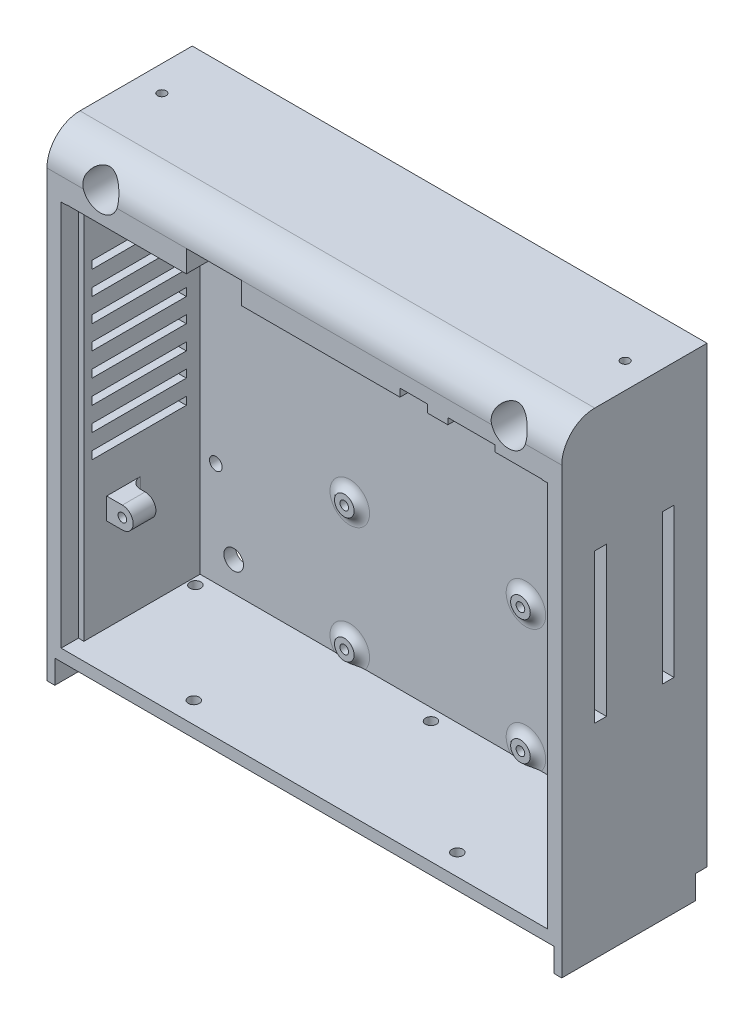
from build123d import *

# Parameters (mm, degrees)
CROQUIS1_W               = 131.1
CROQUIS1_H               = 109.5
SALIENTE_EXTRUIR2_DEPTH  = 39
CORTAR_EXTRUIR1_DEPTH    = 36
SALIENTE_EXTRUIR6_START  = 18
CROQUIS3_R               = 2.75
CROQUIS3_R_2             = 1.1
SALIENTE_EXTRUIR6_DEPTH  = 5.8
REDONDEO1_R              = 2.8
CROQUIS4_W               = 131.1
CROQUIS4_H               = 6
SALIENTE_EXTRUIR7_DEPTH  = 39
CORTAR_EXTRUIR5_START    = -10
CROQUIS7_R               = 1.6
CROQUIS7_R_2             = 1.1
CORTAR_EXTRUIR5_DEPTH    = 10
CROQUIS9_W               = 131.1
CROQUIS9_H               = 115.5
CORTAR_EXTRUIR6_DEPTH    = 2
CROQUIS10_W              = 1.4
CROQUIS10_H              = 98.387821421
CORTAR_EXTRUIR7_DEPTH    = 4.4
CORTAR_EXTRUIR9_REACH    = 180.596
CROQUIS13_R              = 2.5
CROQUIS12_R              = 4.5
CORTAR_EXTRUIR10_DEPTH   = 33
REDONDEO3_R              = 8.4
CORTAR_EXTRUIR11_REACH   = 180.596
CROQUIS15_R              = 1.1
CORTAR_EXTRUIR13_REACH   = 179.998
CROQUIS16_R              = 1.1
SALIENTE_EXTRUIR8_START  = 1.4
CROQUIS17_R              = 2.5
CROQUIS17_R_2            = 1.1
SALIENTE_EXTRUIR8_DEPTH  = 1.4
REDONDEO4_R              = 3
CORTAR_EXTRUIR14_REACH   = 180.596
CROQUIS18_W              = 4.2
CROQUIS18_H              = 16.2
CROQUIS18_H_2            = 14
CROQUIS19_W              = 2
CROQUIS19_H              = 6
SALIENTE_EXTRUIR10_DEPTH = 34
CROQUIS22_R              = 1.4
CORTAR_EXTRUIR19_DEPTH   = 3
CROQUIS5_W               = 24
CROQUIS5_H               = 2
CORTAR_EXTRUIR3_DEPTH    = 10
CROQUIS6_W               = 3
CROQUIS6_H               = 38
CORTAR_EXTRUIR4_DEPTH    = 10


with BuildPart() as part:
    # Croquis1 → Saliente-Extruir2 (new body)
    with BuildSketch(Plane.XY):
        with Locations((65.55, 54.75)):
            Rectangle(CROQUIS1_W, CROQUIS1_H)
    extrude(amount=SALIENTE_EXTRUIR2_DEPTH)

    # Croquis2 → Cortar-Extruir1 (cut)
    with BuildSketch(Plane.XY.offset(39)):
        Polygon((5, 101.5), (35.5, 101.5), (35.5, 107.1), (49.5, 107.1), (49.5, 101.5), (89.9, 101.5), (89.9, 103.5), (96.9, 103.5), (96.9, 101.5), (102.1, 101.5), (102.1, 103.1), (114.1, 103.1), (114.1, 101.5), (126.1, 101.5), (126.1, 3), (5, 3), align=None)
    extrude(amount=-CORTAR_EXTRUIR1_DEPTH, mode=Mode.SUBTRACT)

    # Croquis3 → Saliente-Extruir6 (add)
    # profile 1 of 8: a face of its own
    with BuildSketch(Plane.XY.offset(3).offset(SALIENTE_EXTRUIR6_START)):
        with Locations((9, 97.5)):
            Circle(CROQUIS3_R)
        with Locations((9, 97.5)):
            Circle(CROQUIS3_R_2, mode=Mode.SUBTRACT)
    # profile 2 of 8: a face of its own
    with BuildSketch(Plane.XY.offset(3).offset(SALIENTE_EXTRUIR6_START)):
        with BuildLine():
            ThreePointArc((9, 94.75), (6.25, 97.5), (9, 100.25))
            Line((9, 100.25), (5, 100.25))
            Line((5, 100.25), (5, 94.75))
            Line((5, 94.75), (9, 94.75))
        make_face()
    # profile 3 of 8: a face of its own
    with BuildSketch(Plane.XY.offset(3).offset(SALIENTE_EXTRUIR6_START)):
        with Locations((122.1, 97.5)):
            Circle(CROQUIS3_R)
        with Locations((122.1, 97.5)):
            Circle(CROQUIS3_R_2, mode=Mode.SUBTRACT)
    # profile 4 of 8: a face of its own
    with BuildSketch(Plane.XY.offset(3).offset(SALIENTE_EXTRUIR6_START)):
        with BuildLine():
            Line((122.1, 94.75), (126.1, 94.75))
            Line((126.1, 94.75), (126.1, 100.25))
            Line((126.1, 100.25), (122.1, 100.25))
            ThreePointArc((122.1, 100.25), (124.044543648, 99.444543648), (124.85, 97.5))
            ThreePointArc((124.85, 97.5), (124.044543648, 95.555456352), (122.1, 94.75))
        make_face()
    # profile 5 of 8: a face of its own
    with BuildSketch(Plane.XY.offset(3).offset(SALIENTE_EXTRUIR6_START)):
        with Locations((122.1, 29.4)):
            Circle(CROQUIS3_R)
        with Locations((122.1, 29.4)):
            Circle(CROQUIS3_R_2, mode=Mode.SUBTRACT)
    # profile 6 of 8: a face of its own
    with BuildSketch(Plane.XY.offset(3).offset(SALIENTE_EXTRUIR6_START)):
        with BuildLine():
            ThreePointArc((124.85, 29.4), (124.044543648, 27.455456352), (122.1, 26.65))
            Line((122.1, 26.65), (126.1, 26.65))
            Line((126.1, 26.65), (126.1, 32.15))
            Line((126.1, 32.15), (122.1, 32.15))
            ThreePointArc((122.1, 32.15), (124.044543648, 31.344543648), (124.85, 29.4))
        make_face()
    # profile 7 of 8: a face of its own
    with BuildSketch(Plane.XY.offset(3).offset(SALIENTE_EXTRUIR6_START)):
        with Locations((9, 29.4)):
            Circle(CROQUIS3_R)
        with Locations((9, 29.4)):
            Circle(CROQUIS3_R_2, mode=Mode.SUBTRACT)
    # profile 8 of 8: a face of its own
    with BuildSketch(Plane.XY.offset(3).offset(SALIENTE_EXTRUIR6_START)):
        with BuildLine():
            Line((9, 32.15), (5, 32.15))
            Line((5, 32.15), (5, 26.65))
            Line((5, 26.65), (9, 26.65))
            ThreePointArc((9, 26.65), (6.25, 29.4), (9, 32.15))
        make_face()
    extrude(amount=SALIENTE_EXTRUIR6_DEPTH)

    # Redondeo1
    redondeo1_edges = [part.edges().sort_by_distance(p)[0] for p in [
        (5, 97.5, 21),
        (126.1, 97.5, 21),
        (126.1, 29.4, 21),
        (5, 29.4, 21),
    ]]
    fillet(redondeo1_edges, radius=REDONDEO1_R)

    # Croquis4 → Saliente-Extruir7 (add)
    with BuildSketch(Plane.XY.offset(39)):
        with Locations((65.55, 112.5)):
            Rectangle(CROQUIS4_W, CROQUIS4_H)
    extrude(amount=-SALIENTE_EXTRUIR7_DEPTH)

    # Croquis7 → Cortar-Extruir5 (cut)
    # profile 1 of 8: a face of its own
    with BuildSketch(Plane.XY.offset(3).offset(CORTAR_EXTRUIR5_START)):
        with Locations((9, 97.5)):
            Circle(CROQUIS7_R)
        with Locations((9, 97.5)):
            Circle(CROQUIS7_R_2, mode=Mode.SUBTRACT)
    # profile 2 of 8: a face of its own
    with BuildSketch(Plane.XY.offset(3).offset(CORTAR_EXTRUIR5_START)):
        with Locations((9, 97.5)):
            Circle(CROQUIS7_R_2)
    # profile 3 of 8: a face of its own
    with BuildSketch(Plane.XY.offset(3).offset(CORTAR_EXTRUIR5_START)):
        with Locations((122.1, 97.5)):
            Circle(CROQUIS7_R)
        with Locations((122.1, 97.5)):
            Circle(CROQUIS7_R_2, mode=Mode.SUBTRACT)
    # profile 4 of 8: a face of its own
    with BuildSketch(Plane.XY.offset(3).offset(CORTAR_EXTRUIR5_START)):
        with Locations((122.1, 97.5)):
            Circle(CROQUIS7_R_2)
    # profile 5 of 8: a face of its own
    with BuildSketch(Plane.XY.offset(3).offset(CORTAR_EXTRUIR5_START)):
        with Locations((122.1, 29.4)):
            Circle(CROQUIS7_R)
        with Locations((122.1, 29.4)):
            Circle(CROQUIS7_R_2, mode=Mode.SUBTRACT)
    # profile 6 of 8: a face of its own
    with BuildSketch(Plane.XY.offset(3).offset(CORTAR_EXTRUIR5_START)):
        with Locations((122.1, 29.4)):
            Circle(CROQUIS7_R_2)
    # profile 7 of 8: a face of its own
    with BuildSketch(Plane.XY.offset(3).offset(CORTAR_EXTRUIR5_START)):
        with Locations((9, 29.4)):
            Circle(CROQUIS7_R)
        with Locations((9, 29.4)):
            Circle(CROQUIS7_R_2, mode=Mode.SUBTRACT)
    # profile 8 of 8: a face of its own
    with BuildSketch(Plane.XY.offset(3).offset(CORTAR_EXTRUIR5_START)):
        with Locations((9, 29.4)):
            Circle(CROQUIS7_R_2)
    extrude(amount=CORTAR_EXTRUIR5_DEPTH, mode=Mode.SUBTRACT)

    # Croquis9 → Cortar-Extruir6 (cut)
    with BuildSketch(Plane.XY.offset(39)):
        with Locations((65.55, 57.75)):
            Rectangle(CROQUIS9_W, CROQUIS9_H)
    extrude(amount=-CORTAR_EXTRUIR6_DEPTH, mode=Mode.SUBTRACT)

    # Croquis10 → Cortar-Extruir7 (cut)
    with BuildSketch(Plane.XY.offset(37)):
        with Locations((4.3, 52.193910711)):
            Rectangle(CROQUIS10_W, CROQUIS10_H)
        with Locations((126.8, 52.193910711)):
            Rectangle(CROQUIS10_W, CROQUIS10_H)
    extrude(amount=-CORTAR_EXTRUIR7_DEPTH, mode=Mode.SUBTRACT)

    # Croquis13 → Cortar-Extruir9 (cut, up to next)
    with BuildSketch(Plane.XY.offset(37), mode=Mode.PRIVATE) as cortar_extruir9_sk1:
        with Locations((13.55, 108.5)):
            Circle(CROQUIS13_R)
    cortar_extruir9_tool1 = extrude(cortar_extruir9_sk1.sketch, amount=-CORTAR_EXTRUIR9_REACH, mode=Mode.PRIVATE) & part.part
    # Croquis13 → Cortar-Extruir9 (cut, up to next)
    with BuildSketch(Plane.XY.offset(37), mode=Mode.PRIVATE) as cortar_extruir9_sk2:
        with Locations((117.55, 108.5)):
            Circle(CROQUIS13_R)
    cortar_extruir9_tool2 = extrude(cortar_extruir9_sk2.sketch, amount=-CORTAR_EXTRUIR9_REACH, mode=Mode.PRIVATE) & part.part
    # Croquis13 → Cortar-Extruir9 (cut, up to next)
    with BuildSketch(Plane.XY.offset(37), mode=Mode.PRIVATE) as cortar_extruir9_sk3:
        with Locations(Location((13.55, 10.5, 0), (0, 0, 180))):
            Circle(CROQUIS13_R)
    cortar_extruir9_tool3 = extrude(cortar_extruir9_sk3.sketch, amount=-CORTAR_EXTRUIR9_REACH, mode=Mode.PRIVATE) & part.part
    # Croquis13 → Cortar-Extruir9 (cut, up to next)
    with BuildSketch(Plane.XY.offset(37), mode=Mode.PRIVATE) as cortar_extruir9_sk4:
        with Locations(Location((117.55, 10.5, 0), (0, 0, 180))):
            Circle(CROQUIS13_R)
    cortar_extruir9_tool4 = extrude(cortar_extruir9_sk4.sketch, amount=-CORTAR_EXTRUIR9_REACH, mode=Mode.PRIVATE) & part.part
    add(cortar_extruir9_tool1.solids().sort_by_distance((13.55, 108.5, 37))[0], mode=Mode.SUBTRACT)
    add(cortar_extruir9_tool2.solids().sort_by_distance((117.55, 108.5, 37))[0], mode=Mode.SUBTRACT)
    add(cortar_extruir9_tool3.solids().sort_by_distance((13.55, 10.5, 37))[0], mode=Mode.SUBTRACT)
    add(cortar_extruir9_tool4.solids().sort_by_distance((117.55, 10.5, 37))[0], mode=Mode.SUBTRACT)

    # Croquis12 → Cortar-Extruir10 (cut)
    with BuildSketch(Plane.XY.offset(37)):
        with Locations((13.55, 108.5)):
            Circle(CROQUIS12_R)
        with Locations(Location((117.55, 108.5, 0), (0, 0, 180))):
            Circle(CROQUIS12_R)
        with Locations((13.55, 10.5)):
            Circle(CROQUIS12_R)
        with Locations((117.55, 10.5)):
            Circle(CROQUIS12_R)
    extrude(amount=-CORTAR_EXTRUIR10_DEPTH, mode=Mode.SUBTRACT)

    # Redondeo3
    # the kernel refuses this fillet: 8.4 mm, written as the material it takes off along each edge
    with BuildSketch(Plane(origin=(152.1, 115.5, 37), x_dir=(0, -1, 0), z_dir=(-1, 0, 0))) as redondeo3_piece_1:
        with BuildLine():
            CenterArc((REDONDEO3_R, -REDONDEO3_R), REDONDEO3_R, 90, 90)
            Line((0, -REDONDEO3_R), (0, 0))
            Line((0, 0), (REDONDEO3_R, 0))
        make_face()
    extrude(amount=173.1, mode=Mode.SUBTRACT)

    # Croquis15 → Cortar-Extruir11 (cut, up to next)
    with BuildSketch(Plane(origin=(0, 115.5, 0), x_dir=(1, 0, 0), z_dir=(0, 1, 0)), mode=Mode.PRIVATE) as cortar_extruir11_sk1:
        with Locations(Location((6.55, -14.3, 0), (0, 0, 180))):
            Circle(CROQUIS15_R)
    cortar_extruir11_tool1 = extrude(cortar_extruir11_sk1.sketch, amount=-CORTAR_EXTRUIR11_REACH, mode=Mode.PRIVATE) & part.part
    # Croquis15 → Cortar-Extruir11 (cut, up to next)
    with BuildSketch(Plane(origin=(0, 115.5, 0), x_dir=(1, 0, 0), z_dir=(0, 1, 0)), mode=Mode.PRIVATE) as cortar_extruir11_sk2:
        with Locations(Location((124.55, -14.3, 0), (0, 0, 90))):
            Circle(CROQUIS15_R)
    cortar_extruir11_tool2 = extrude(cortar_extruir11_sk2.sketch, amount=-CORTAR_EXTRUIR11_REACH, mode=Mode.PRIVATE) & part.part
    add(cortar_extruir11_tool1.solids().sort_by_distance((6.55, 115.5, 14.3))[0], mode=Mode.SUBTRACT)
    add(cortar_extruir11_tool2.solids().sort_by_distance((124.55, 115.5, 14.3))[0], mode=Mode.SUBTRACT)

    # Croquis16 → Cortar-Extruir13 (cut, up to next)
    with BuildSketch(Plane.XY.offset(3), mode=Mode.PRIVATE) as cortar_extruir13_sk1:
        with Locations((43.12, 37.93)):
            Circle(CROQUIS16_R)
    cortar_extruir13_tool1 = extrude(cortar_extruir13_sk1.sketch, amount=-CORTAR_EXTRUIR13_REACH, mode=Mode.PRIVATE) & part.part
    # Croquis16 → Cortar-Extruir13 (cut, up to next)
    with BuildSketch(Plane.XY.offset(3), mode=Mode.PRIVATE) as cortar_extruir13_sk2:
        with Locations((87.98, 37.93)):
            Circle(CROQUIS16_R)
    cortar_extruir13_tool2 = extrude(cortar_extruir13_sk2.sketch, amount=-CORTAR_EXTRUIR13_REACH, mode=Mode.PRIVATE) & part.part
    # Croquis16 → Cortar-Extruir13 (cut, up to next)
    with BuildSketch(Plane.XY.offset(3), mode=Mode.PRIVATE) as cortar_extruir13_sk3:
        with Locations((87.98, 6.17)):
            Circle(CROQUIS16_R)
    cortar_extruir13_tool3 = extrude(cortar_extruir13_sk3.sketch, amount=-CORTAR_EXTRUIR13_REACH, mode=Mode.PRIVATE) & part.part
    # Croquis16 → Cortar-Extruir13 (cut, up to next)
    with BuildSketch(Plane.XY.offset(3), mode=Mode.PRIVATE) as cortar_extruir13_sk4:
        with Locations((43.12, 6.17)):
            Circle(CROQUIS16_R)
    cortar_extruir13_tool4 = extrude(cortar_extruir13_sk4.sketch, amount=-CORTAR_EXTRUIR13_REACH, mode=Mode.PRIVATE) & part.part
    add(cortar_extruir13_tool1.solids().sort_by_distance((43.12, 37.93, 3))[0], mode=Mode.SUBTRACT)
    add(cortar_extruir13_tool2.solids().sort_by_distance((87.98, 37.93, 3))[0], mode=Mode.SUBTRACT)
    add(cortar_extruir13_tool3.solids().sort_by_distance((87.98, 6.17, 3))[0], mode=Mode.SUBTRACT)
    add(cortar_extruir13_tool4.solids().sort_by_distance((43.12, 6.17, 3))[0], mode=Mode.SUBTRACT)

    # Croquis17 → Saliente-Extruir8 (add)
    # profile 1 of 4: a face of its own
    with BuildSketch(Plane.XY.offset(3).offset(SALIENTE_EXTRUIR8_START)):
        with Locations(Location((43.12, 37.93, 0), (0, 0, 180))):
            Circle(CROQUIS17_R)
        with Locations((43.12, 37.93)):
            Circle(CROQUIS17_R_2, mode=Mode.SUBTRACT)
    # profile 2 of 4: a face of its own
    with BuildSketch(Plane.XY.offset(3).offset(SALIENTE_EXTRUIR8_START)):
        with Locations(Location((87.98, 37.93, 0), (0, 0, 180))):
            Circle(CROQUIS17_R)
        with Locations((87.98, 37.93)):
            Circle(CROQUIS17_R_2, mode=Mode.SUBTRACT)
    # profile 3 of 4: a face of its own
    with BuildSketch(Plane.XY.offset(3).offset(SALIENTE_EXTRUIR8_START)):
        with Locations(Location((87.98, 6.17, 0), (0, 0, 180))):
            Circle(CROQUIS17_R)
        with Locations((87.98, 6.17)):
            Circle(CROQUIS17_R_2, mode=Mode.SUBTRACT)
    # profile 4 of 4: a face of its own
    with BuildSketch(Plane.XY.offset(3).offset(SALIENTE_EXTRUIR8_START)):
        with Locations(Location((43.12, 6.17, 0), (0, 0, 180))):
            Circle(CROQUIS17_R)
        with Locations((43.12, 6.17)):
            Circle(CROQUIS17_R_2, mode=Mode.SUBTRACT)
    extrude(amount=-SALIENTE_EXTRUIR8_DEPTH)

    # Redondeo4
    # the kernel refuses this fillet: 3 mm, written as the material it adds along each edge
    with BuildSketch(Plane(origin=(43.12, 37.93, 3), x_dir=(-1, 0, 0), z_dir=(0, 1, 0))) as redondeo4_piece_1:
        with BuildLine():
            CenterArc((5.037715508, 3), REDONDEO4_R, 212.230952635, 57.769047365)
            Line((5.037715508, 0), (5.037715508, -0.06))
            Line((5.037715508, -0.06), (2.5, -0.06))
            Line((2.5, -0.06), (2.44, 0))
            ThreePointArc((2.44, 0), (2.44, 0.7), (2.44924569, 1.368))
            Line((2.44924569, 1.368), (2.5, 1.4))
        make_face()
    revolve(axis=Axis((43.12, 37.93, 3), (0, 0, 1)))
    with BuildSketch(Plane(origin=(87.98, 37.93, 3), x_dir=(-1, 0, 0), z_dir=(0, 1, 0))) as redondeo4_piece_2:
        with BuildLine():
            CenterArc((5.037715508, 3), REDONDEO4_R, 212.230952635, 57.769047365)
            Line((5.037715508, 0), (5.037715508, -0.06))
            Line((5.037715508, -0.06), (2.5, -0.06))
            Line((2.5, -0.06), (2.44, 0))
            ThreePointArc((2.44, 0), (2.44, 0.7), (2.44924569, 1.368))
            Line((2.44924569, 1.368), (2.5, 1.4))
        make_face()
    revolve(axis=Axis((87.98, 37.93, 3), (0, 0, 1)))
    with BuildSketch(Plane(origin=(87.98, 6.17, 3), x_dir=(-1, 0, 0), z_dir=(0, 1, 0))) as redondeo4_piece_3:
        with BuildLine():
            CenterArc((5.037715508, 3), REDONDEO4_R, 212.230952635, 57.769047365)
            Line((5.037715508, 0), (5.037715508, -0.06))
            Line((5.037715508, -0.06), (2.5, -0.06))
            Line((2.5, -0.06), (2.44, 0))
            ThreePointArc((2.44, 0), (2.44, 0.7), (2.44924569, 1.368))
            Line((2.44924569, 1.368), (2.5, 1.4))
        make_face()
    revolve(axis=Axis((87.98, 6.17, 3), (0, 0, 1)))
    with BuildSketch(Plane(origin=(43.12, 6.17, 3), x_dir=(-1, 0, 0), z_dir=(0, 1, 0))) as redondeo4_piece_4:
        with BuildLine():
            CenterArc((5.037715508, 3), REDONDEO4_R, 212.230952635, 57.769047365)
            Line((5.037715508, 0), (5.037715508, -0.06))
            Line((5.037715508, -0.06), (2.5, -0.06))
            Line((2.5, -0.06), (2.44, 0))
            ThreePointArc((2.44, 0), (2.44, 0.7), (2.44924569, 1.368))
            Line((2.44924569, 1.368), (2.5, 1.4))
        make_face()
    revolve(axis=Axis((43.12, 6.17, 3), (0, 0, 1)))

    # Croquis18 → Cortar-Extruir14 (cut, up to next)
    with BuildSketch(Plane.XZ, mode=Mode.PRIVATE) as cortar_extruir14_sk1:
        with Locations((65.55, 18.5)):
            Rectangle(CROQUIS18_W, CROQUIS18_H)
    cortar_extruir14_tool1 = extrude(cortar_extruir14_sk1.sketch, amount=-CORTAR_EXTRUIR14_REACH, mode=Mode.PRIVATE) & part.part
    # Croquis18 → Cortar-Extruir14 (cut, up to next)
    with BuildSketch(Plane.XZ, mode=Mode.PRIVATE) as cortar_extruir14_sk2:
        with Locations((48.9, 18.5)):
            Rectangle(CROQUIS18_W, CROQUIS18_H_2)
    cortar_extruir14_tool2 = extrude(cortar_extruir14_sk2.sketch, amount=-CORTAR_EXTRUIR14_REACH, mode=Mode.PRIVATE) & part.part
    # Croquis18 → Cortar-Extruir14 (cut, up to next)
    with BuildSketch(Plane.XZ, mode=Mode.PRIVATE) as cortar_extruir14_sk3:
        with Locations((101.2, 18.5)):
            Rectangle(CROQUIS18_W, CROQUIS18_H)
    cortar_extruir14_tool3 = extrude(cortar_extruir14_sk3.sketch, amount=-CORTAR_EXTRUIR14_REACH, mode=Mode.PRIVATE) & part.part
    add(cortar_extruir14_tool1.solids().sort_by_distance((65.55, 0, 18.5))[0], mode=Mode.SUBTRACT)
    add(cortar_extruir14_tool2.solids().sort_by_distance((48.9, 0, 18.5))[0], mode=Mode.SUBTRACT)
    add(cortar_extruir14_tool3.solids().sort_by_distance((101.2, 0, 18.5))[0], mode=Mode.SUBTRACT)

    # Croquis19 → Saliente-Extruir10 (add)
    with BuildSketch(Plane.XY.offset(37)):
        with Locations((1, -3)):
            Rectangle(CROQUIS19_W, CROQUIS19_H)
        with Locations((1, -3)):
            Rectangle(CROQUIS19_W, CROQUIS19_H)
        with BuildLine():
            Line((0, 107.1), (0, 0))
            Line((0, 0), (2, 0))
            Line((2, 0), (57, 0))
            Line((57, 0), (59, 0))
            Line((59, 0), (91.1, 0))
            Line((91.1, 0), (93.1, 0))
            Line((93.1, 0), (129.1, 0))
            Line((129.1, 0), (131.1, 0))
            Line((131.1, 0), (131.1, 107.1))
            Line((131.1, 107.1), (121.826680956, 107.1))
            ThreePointArc((121.826680956, 107.1), (117.55, 104), (113.273319044, 107.1))
            Line((113.273319044, 107.1), (49.5, 107.1))
            Line((49.5, 107.1), (49.5, 101.5))
            Line((49.5, 101.5), (89.9, 101.5))
            Line((89.9, 101.5), (89.9, 103.5))
            Line((89.9, 103.5), (96.9, 103.5))
            Line((96.9, 103.5), (96.9, 101.5))
            Line((96.9, 101.5), (102.1, 101.5))
            Line((102.1, 101.5), (102.1, 103.1))
            Line((102.1, 103.1), (114.1, 103.1))
            Line((114.1, 103.1), (114.1, 101.5))
            Line((114.1, 101.5), (126.1, 101.5))
            Line((126.1, 101.5), (126.1, 101.387821421))
            Line((126.1, 101.387821421), (127.5, 101.387821421))
            Line((127.5, 101.387821421), (127.5, 3))
            Line((127.5, 3), (3.6, 3))
            Line((3.6, 3), (3.6, 101.387821421))
            Line((3.6, 101.387821421), (5, 101.387821421))
            Line((5, 101.387821421), (5, 101.5))
            Line((5, 101.5), (35.5, 101.5))
            Line((35.5, 101.5), (35.5, 107.1))
            Line((35.5, 107.1), (17.826680956, 107.1))
            ThreePointArc((17.826680956, 107.1), (13.55, 104), (9.273319044, 107.1))
            Line((9.273319044, 107.1), (0, 107.1))
        make_face()
        with Locations((130.1, -3)):
            Rectangle(CROQUIS19_W, CROQUIS19_H)
        with BuildLine():
            Line((0, 107.1), (0, 0))
            Line((0, 0), (2, 0))
            Line((2, 0), (57, 0))
            Line((57, 0), (59, 0))
            Line((59, 0), (91.1, 0))
            Line((91.1, 0), (93.1, 0))
            Line((93.1, 0), (129.1, 0))
            Line((129.1, 0), (131.1, 0))
            Line((131.1, 0), (131.1, 107.1))
            Line((131.1, 107.1), (121.826680956, 107.1))
            ThreePointArc((121.826680956, 107.1), (117.55, 104), (113.273319044, 107.1))
            Line((113.273319044, 107.1), (49.5, 107.1))
            Line((49.5, 107.1), (49.5, 101.5))
            Line((49.5, 101.5), (89.9, 101.5))
            Line((89.9, 101.5), (89.9, 103.5))
            Line((89.9, 103.5), (96.9, 103.5))
            Line((96.9, 103.5), (96.9, 101.5))
            Line((96.9, 101.5), (102.1, 101.5))
            Line((102.1, 101.5), (102.1, 103.1))
            Line((102.1, 103.1), (114.1, 103.1))
            Line((114.1, 103.1), (114.1, 101.5))
            Line((114.1, 101.5), (126.1, 101.5))
            Line((126.1, 101.5), (126.1, 101.387821421))
            Line((126.1, 101.387821421), (127.5, 101.387821421))
            Line((127.5, 101.387821421), (127.5, 3))
            Line((127.5, 3), (3.6, 3))
            Line((3.6, 3), (3.6, 101.387821421))
            Line((3.6, 101.387821421), (5, 101.387821421))
            Line((5, 101.387821421), (5, 101.5))
            Line((5, 101.5), (35.5, 101.5))
            Line((35.5, 101.5), (35.5, 107.1))
            Line((35.5, 107.1), (17.826680956, 107.1))
            ThreePointArc((17.826680956, 107.1), (13.55, 104), (9.273319044, 107.1))
            Line((9.273319044, 107.1), (0, 107.1))
        make_face()
        with BuildLine():
            Line((0, 107.1), (0, 0))
            Line((0, 0), (2, 0))
            Line((2, 0), (57, 0))
            Line((57, 0), (59, 0))
            Line((59, 0), (91.1, 0))
            Line((91.1, 0), (93.1, 0))
            Line((93.1, 0), (129.1, 0))
            Line((129.1, 0), (131.1, 0))
            Line((131.1, 0), (131.1, 107.1))
            Line((131.1, 107.1), (121.826680956, 107.1))
            ThreePointArc((121.826680956, 107.1), (117.55, 104), (113.273319044, 107.1))
            Line((113.273319044, 107.1), (49.5, 107.1))
            Line((49.5, 107.1), (49.5, 101.5))
            Line((49.5, 101.5), (89.9, 101.5))
            Line((89.9, 101.5), (89.9, 103.5))
            Line((89.9, 103.5), (96.9, 103.5))
            Line((96.9, 103.5), (96.9, 101.5))
            Line((96.9, 101.5), (102.1, 101.5))
            Line((102.1, 101.5), (102.1, 103.1))
            Line((102.1, 103.1), (114.1, 103.1))
            Line((114.1, 103.1), (114.1, 101.5))
            Line((114.1, 101.5), (126.1, 101.5))
            Line((126.1, 101.5), (126.1, 101.387821421))
            Line((126.1, 101.387821421), (127.5, 101.387821421))
            Line((127.5, 101.387821421), (127.5, 3))
            Line((127.5, 3), (3.6, 3))
            Line((3.6, 3), (3.6, 101.387821421))
            Line((3.6, 101.387821421), (5, 101.387821421))
            Line((5, 101.387821421), (5, 101.5))
            Line((5, 101.5), (35.5, 101.5))
            Line((35.5, 101.5), (35.5, 107.1))
            Line((35.5, 107.1), (17.826680956, 107.1))
            ThreePointArc((17.826680956, 107.1), (13.55, 104), (9.273319044, 107.1))
            Line((9.273319044, 107.1), (0, 107.1))
        make_face()
    extrude(amount=-SALIENTE_EXTRUIR10_DEPTH)

    # Croquis22 → Cortar-Extruir19 (cut)
    with BuildSketch(Plane.XZ):
        with Locations(Location((6.8, 6, 0), (0, 0, 270))):
            Circle(CROQUIS22_R)
        with Locations(Location((66.8, 6, 0), (0, 0, 270))):
            Circle(CROQUIS22_R)
        with Locations(Location((124.3, 6, 0), (0, 0, 270))):
            Circle(CROQUIS22_R)
        with Locations(Location((32, 31.6, 0), (0, 0, 270))):
            Circle(CROQUIS22_R)
        with Locations(Location((99.1, 31.6, 0), (0, 0, 270))):
            Circle(CROQUIS22_R)
    extrude(amount=-CORTAR_EXTRUIR19_DEPTH, mode=Mode.SUBTRACT)

    # Croquis5 → Cortar-Extruir3 (cut, symmetric)
    with BuildSketch(Plane.ZY):
        with Locations((18.5, 49)):
            Rectangle(CROQUIS5_W, CROQUIS5_H)
        with Locations((18.5, 43)):
            Rectangle(CROQUIS5_W, CROQUIS5_H)
        with Locations((18.5, 55)):
            Rectangle(CROQUIS5_W, CROQUIS5_H)
        with Locations((18.5, 61)):
            Rectangle(CROQUIS5_W, CROQUIS5_H)
        with Locations((18.5, 67)):
            Rectangle(CROQUIS5_W, CROQUIS5_H)
        with Locations((18.5, 73)):
            Rectangle(CROQUIS5_W, CROQUIS5_H)
        with Locations((18.5, 79)):
            Rectangle(CROQUIS5_W, CROQUIS5_H)
        with Locations((18.5, 85)):
            Rectangle(CROQUIS5_W, CROQUIS5_H)
    extrude(amount=CORTAR_EXTRUIR3_DEPTH, both=True, mode=Mode.SUBTRACT)

    # Croquis6 → Cortar-Extruir4 (cut)
    with BuildSketch(Plane(origin=(131.1, 0, 0), x_dir=(0, 0, -1), z_dir=(1, 0, 0))):
        with Locations((-27.1, 65)):
            Rectangle(CROQUIS6_W, CROQUIS6_H)
        with Locations((-9.9, 65)):
            Rectangle(CROQUIS6_W, CROQUIS6_H)
    extrude(amount=-CORTAR_EXTRUIR4_DEPTH, mode=Mode.SUBTRACT)


solid = part.part
